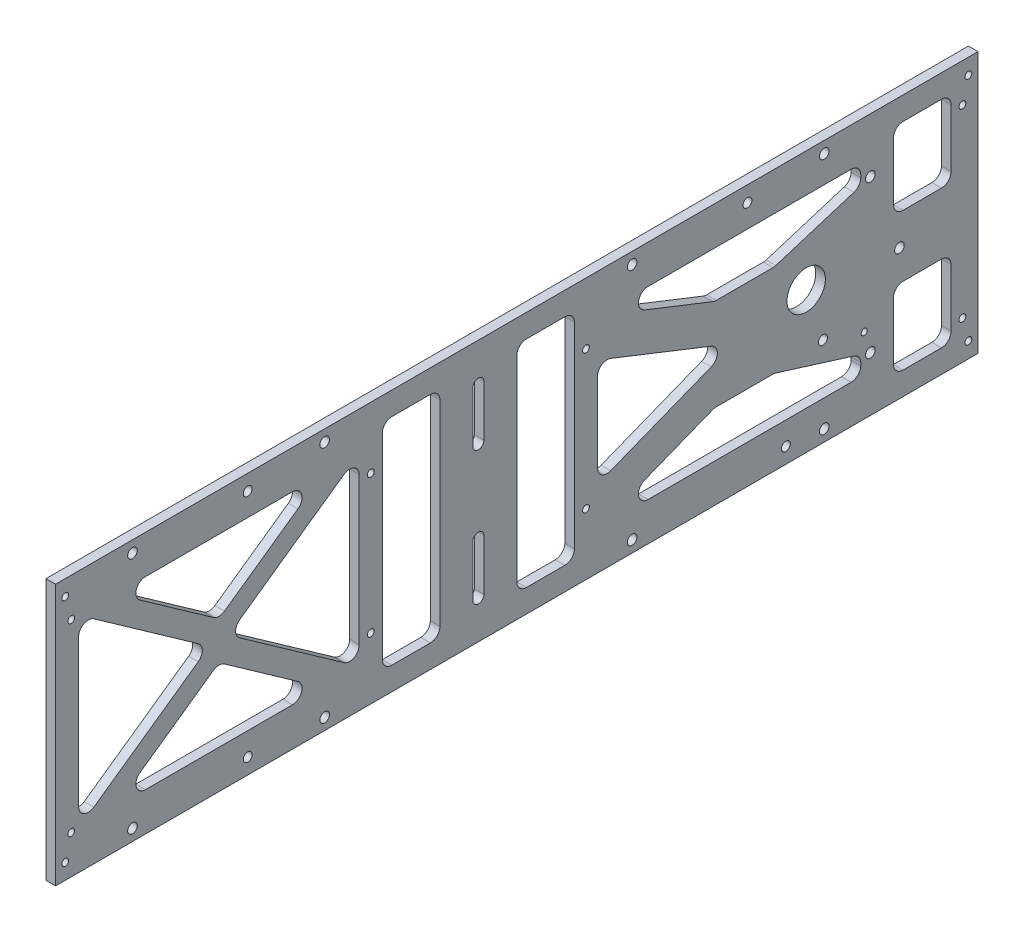
from build123d import *

# Parameters (mm, degrees)
SKETCH1_W                               = 304.8
SKETCH1_H                               = 86.36
BOSS_EXTRUDE1_DEPTH                     = 3.175
F_1_8_0_125_PRESS_DOWEL_HOLE1_OUTLINE_R = 1.5875
F_1_8_0_125_PRESS_DOWEL_HOLE1_DEPTH     = 3.175
CUT_EXTRUDE1_DEPTH                      = 317.814094107
SKETCH7_W                               = 19.05
SKETCH7_H                               = 25.4
SKETCH7_H_2                             = 71.12
CUT_EXTRUDE2_DEPTH                      = 317.814094107
FILLET1_R                               = 3.175
F_1_2_0_5_PRESS_DOWEL_HOLE1_D           = 12.7
F_3_0MM_PRESS_DOWEL_HOLE1_D             = 3
F_3_0MM_PRESS_DOWEL_HOLE1_DEPTH         = 3.175
F_3_0MM_PRESS_DOWEL_HOLE1_TIP           = 0.901290929
F_2_0MM_PRESS_DOWEL_HOLE1_D             = 2
F_2_0MM_PRESS_DOWEL_HOLE1_DEPTH         = 3.175
F_2_0MM_PRESS_DOWEL_HOLE1_TIP           = 0.600860619
F_4_40_TAPPED_HOLE2_D                   = 2.2606
F_1_8_0_125_DIAMETER_HOLE1_D            = 3.175
F_4_CLEARANCE_HOLE1_D                   = 2.9464
F_4_CLEARANCE_HOLE1_DEPTH               = 9.1694
F_4_CLEARANCE_HOLE1_TIP                 = 0.885187864


# Read off the part's stored shape, not the designer's step: 1/8 (0.125) Press Dowel Hole1
with BuildPart() as part:
    # Sketch1 → Boss-Extrude1 (new body)
    with BuildSketch(Plane(origin=(0, 0, 0), x_dir=(0, 0, -1), z_dir=(1, 0, 0))):
        with Locations((152.4, 43.18)):
            Rectangle(SKETCH1_W, SKETCH1_H)
    extrude(amount=BOSS_EXTRUDE1_DEPTH)

    # 1/8 (0.125) Press Dowel Hole1 outline → 1/8 (0.125) Press Dowel Hole1 (cut)
    with BuildSketch(Plane.YZ):
        with Locations((68.36, -269.24)):
            Circle(F_1_8_0_125_PRESS_DOWEL_HOLE1_OUTLINE_R)
        with Locations((18, -269.24)):
            Circle(F_1_8_0_125_PRESS_DOWEL_HOLE1_OUTLINE_R)
        with Locations((82.55, -25.4)):
            Circle(F_1_8_0_125_PRESS_DOWEL_HOLE1_OUTLINE_R)
        with Locations((82.55, -88.9)):
            Circle(F_1_8_0_125_PRESS_DOWEL_HOLE1_OUTLINE_R)
        with Locations((82.55, -190.5)):
            Circle(F_1_8_0_125_PRESS_DOWEL_HOLE1_OUTLINE_R)
        with Locations((82.55, -254)):
            Circle(F_1_8_0_125_PRESS_DOWEL_HOLE1_OUTLINE_R)
        with Locations((3.81, -254)):
            Circle(F_1_8_0_125_PRESS_DOWEL_HOLE1_OUTLINE_R)
        with Locations((3.81, -190.5)):
            Circle(F_1_8_0_125_PRESS_DOWEL_HOLE1_OUTLINE_R)
        with Locations((3.81, -88.9)):
            Circle(F_1_8_0_125_PRESS_DOWEL_HOLE1_OUTLINE_R)
        with Locations((3.81, -25.4)):
            Circle(F_1_8_0_125_PRESS_DOWEL_HOLE1_OUTLINE_R)
    extrude(amount=F_1_8_0_125_PRESS_DOWEL_HOLE1_DEPTH, mode=Mode.SUBTRACT)

    # Sketch6 → Cut-Extrude1 (cut, through all)
    with BuildSketch(Plane(origin=(3.175, 0, 0), x_dir=(0, 0, -1), z_dir=(1, 0, 0))):
        with BuildLine():
            Line((141.5288, 73.66), (141.5288, 56.781492032))
            ThreePointArc((141.5288, 56.781492032), (139.7, 54.952692032), (137.8712, 56.781492032))
            Line((137.8712, 56.781492032), (137.8712, 73.66))
            ThreePointArc((137.8712, 73.66), (139.7, 75.4888), (141.5288, 73.66))
        make_face()
        with BuildLine():
            Line((141.5288, 12.7), (141.5288, 29.578507968))
            ThreePointArc((141.5288, 29.578507968), (139.7, 31.407307968), (137.8712, 29.578507968))
            Line((137.8712, 29.578507968), (137.8712, 12.7))
            ThreePointArc((137.8712, 12.7), (139.7, 10.8712), (141.5288, 12.7))
        make_face()
    extrude(amount=-CUT_EXTRUDE1_DEPTH, mode=Mode.SUBTRACT)

    # Sketch7 → Cut-Extrude2 (cut, through all)
    with BuildSketch(Plane(origin=(3.175, 0, 0), x_dir=(0, 0, -1), z_dir=(1, 0, 0))):
        Polygon((7.62, 73.66), (7.62, 12.7), (50.8, 43.18), align=None)
        with Locations((286.385, 66.04)):
            Rectangle(SKETCH7_W, SKETCH7_H)
        Polygon((100.33, 12.7), (57.15, 43.18), (100.33, 73.66), align=None)
        with Locations((161.925, 43.18)):
            Rectangle(SKETCH7_W, SKETCH7_H_2)
        Polygon((179.07, 25.4), (224.15112849, 43.18), (179.07, 60.96), align=None)
        Polygon((53.975, 73.66), (88.265, 73.66), (53.975, 49.455294118), (19.685, 73.66), align=None)
        Polygon((53.975, 36.904705882), (19.685, 12.7), (53.975, 12.7), (88.265, 12.7), align=None)
        Polygon((179.07, 12.7), (217.710967277, 27.94), (237.51919806, 27.94), (266.065, 19.05), (266.065, 12.7), (225.425, 12.7), align=None)
        Polygon((217.710967277, 58.42), (237.51919806, 58.42), (266.065, 67.31), (266.065, 73.66), (225.425, 73.66), (179.07, 73.66), align=None)
        with Locations((286.385, 20.32)):
            Rectangle(SKETCH7_W, SKETCH7_H)
        with Locations((117.475, 43.18)):
            Rectangle(SKETCH7_W, SKETCH7_H_2)
    extrude(amount=-CUT_EXTRUDE2_DEPTH, mode=Mode.SUBTRACT)

    # Fillet1
    fillet1_edges = [part.edges().sort_by_distance(p)[0] for p in [
        (1.5875, 73.66, -7.62),
        (1.5875, 43.18, -50.8),
        (1.5875, 12.7, -7.62),
        (1.5875, 53.34, -276.86),
        (1.5875, 78.74, -276.86),
        (1.5875, 78.74, -295.91),
        (1.5875, 53.34, -295.91),
        (1.5875, 73.66, -100.33),
        (1.5875, 12.7, -100.33),
        (1.5875, 43.18, -57.15),
        (1.5875, 12.7, -179.07),
        (1.5875, 27.94, -217.710967277),
        (1.5875, 27.94, -237.51919806),
        (1.5875, 19.05, -266.065),
        (1.5875, 12.7, -266.065),
        (1.5875, 25.4, -179.07),
        (1.5875, 60.96, -179.07),
        (1.5875, 43.18, -224.15112849),
        (1.5875, 73.66, -19.685),
        (1.5875, 73.66, -88.265),
        (1.5875, 49.455294118, -53.975),
        (1.5875, 36.904705882, -53.975),
        (1.5875, 12.7, -88.265),
        (1.5875, 12.7, -19.685),
        (1.5875, 73.66, -266.065),
        (1.5875, 67.31, -266.065),
        (1.5875, 58.42, -237.51919806),
        (1.5875, 58.42, -217.710967277),
        (1.5875, 73.66, -179.07),
        (1.5875, 7.62, -152.4),
        (1.5875, 78.74, -152.4),
        (1.5875, 78.74, -171.45),
        (1.5875, 7.62, -171.45),
        (1.5875, 7.62, -276.86),
        (1.5875, 33.02, -276.86),
        (1.5875, 33.02, -295.91),
        (1.5875, 7.62, -295.91),
        (1.5875, 7.62, -107.95),
        (1.5875, 78.74, -107.95),
        (1.5875, 78.74, -127),
        (1.5875, 7.62, -127),
    ]]
    fillet(fillet1_edges, radius=FILLET1_R)

    # 1/2 (0.5) Press Dowel Hole1 (through all)
    with Locations(Plane.ZY):
        with Locations((-248.01972494, 46.53348834)):
            Hole(F_1_2_0_5_PRESS_DOWEL_HOLE1_D / 2)

    # Ø3.0mm Press Dowel Hole1
    with Locations(Plane.ZY):
        with Locations((-253.55249518, 29.46260554)):
            Hole(F_3_0MM_PRESS_DOWEL_HOLE1_D / 2, depth=F_3_0MM_PRESS_DOWEL_HOLE1_DEPTH)
            with Locations((0, 0, -(F_3_0MM_PRESS_DOWEL_HOLE1_DEPTH + F_3_0MM_PRESS_DOWEL_HOLE1_TIP / 2))):  # 118° drill point
                Cone(0, F_3_0MM_PRESS_DOWEL_HOLE1_D / 2, F_3_0MM_PRESS_DOWEL_HOLE1_TIP, mode=Mode.SUBTRACT)

    # Ø2.0mm Press Dowel Hole1
    with Locations(Plane.ZY):
        with Locations((-267.20941224, 24.95127344)):
            Hole(F_2_0MM_PRESS_DOWEL_HOLE1_D / 2, depth=F_2_0MM_PRESS_DOWEL_HOLE1_DEPTH)
            with Locations((0, 0, -(F_2_0MM_PRESS_DOWEL_HOLE1_DEPTH + F_2_0MM_PRESS_DOWEL_HOLE1_TIP / 2))):  # 118° drill point
                Cone(0, F_2_0MM_PRESS_DOWEL_HOLE1_D / 2, F_2_0MM_PRESS_DOWEL_HOLE1_TIP, mode=Mode.SUBTRACT)

    # #4-40 Tapped Hole2 (through all)
    with Locations(Plane(origin=(3.175, 0, 0), x_dir=(0, 0, -1), z_dir=(1, 0, 0))):
        with Locations((301.625, 81.2038), (301.625, 5.1562), (3.175, 81.2038), (3.175, 5.1562), (175.26, 66.04), (175.26, 20.32), (104.14, 66.04), (104.14, 20.32), (5.1562, 12.7), (5.1562, 73.66), (299.6438, 73.66), (299.6438, 12.7)):
            Hole(F_4_40_TAPPED_HOLE2_D / 2)

    # 1/8 (0.125) Diameter Hole1 (through all)
    with Locations(Plane(origin=(3.175, 0, 0), x_dir=(0, 0, -1), z_dir=(1, 0, 0))):
        with Locations((278.835955069, 43.18)):
            Hole(F_1_8_0_125_DIAMETER_HOLE1_D / 2)

    # #4 Clearance Hole1
    with Locations(Plane(origin=(3.175, 0, 0), x_dir=(0, 0, -1), z_dir=(1, 0, 0))):
        with Locations((228.6, 81.2038), (63.5, 81.2038), (63.5, 5.1562), (241.3, 5.1562)):
            Hole(F_4_CLEARANCE_HOLE1_D / 2, depth=F_4_CLEARANCE_HOLE1_DEPTH)
            with Locations((0, 0, -(F_4_CLEARANCE_HOLE1_DEPTH + F_4_CLEARANCE_HOLE1_TIP / 2))):  # 118° drill point
                Cone(0, F_4_CLEARANCE_HOLE1_D / 2, F_4_CLEARANCE_HOLE1_TIP, mode=Mode.SUBTRACT)


solid = part.part
